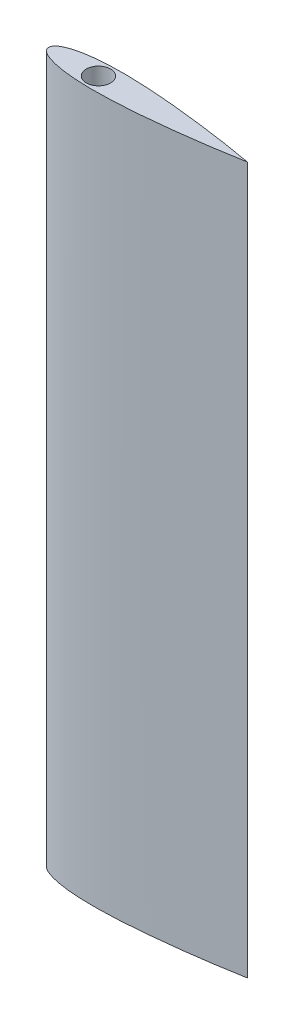
from build123d import *

# Parameters (mm, degrees)
SKETCH1_2_R        = 3.175
CUT_EXTRUDE2_DEPTH = 193.130237992


with BuildPart() as part:
    # rootSketch → Loft1 section 0
    with BuildSketch(Plane(origin=(0, 31.75, 0), x_dir=(1, 0, 0), z_dir=(0, 1, 0))):
        with BuildLine():
            add(Edge.make_bspline(
                [(0, 0), (-1.6572e-05, 0.056577364), (0.005364667, 0.148026672), (0.026073501, 0.280241396), (0.077769955, 0.452215412), (0.147060273, 0.611874915), (0.248525433, 0.785971359), (0.39236103, 0.977542518), (0.599181982, 1.195423819), (0.905829823, 1.451816919), (1.370469676, 1.757918922), (2.078266075, 2.119108524), (3.175731681, 2.542039428), (4.823252293, 2.99869744), (7.275411011, 3.452976612), (10.438659341, 3.780475746), (14.129329887, 3.929259057), (18.143568779, 3.896250983), (22.151742679, 3.722301475), (25.656241741, 3.475962342), (28.651461505, 3.213566971), (31.650711737, 2.914013348), (34.134157887, 2.639630917), (36.639458817, 2.336640809), (39.599525944, 1.953685828), (42.127939329, 1.60070159), (44.533194308, 1.24753169), (47.121130826, 0.837424538), (48.910319544, 0.545474341), (50.6553202, 0.241362714), (51.550989041, 0.081579679), (52, 0)],
                knots=[0, 0, 0, 0, 0, 0.003840944, 0.006235023, 0.009072291, 0.01219322, 0.015656839, 0.019917177, 0.025338962, 0.032592504, 0.042799388, 0.05770457, 0.079310668, 0.112503101, 0.158972616, 0.227236465, 0.295500326, 0.36376419, 0.432028053, 0.500291915, 0.534423847, 0.56855578, 0.636819643, 0.670951575, 0.705083508, 0.773347371, 0.807479302, 0.841611234, 0.875743167, 0.9098751, 0.9098751, 0.9098751, 0.9098751, 0.9098751], degree=4))
            add(Edge.make_bspline(
                [(0, 0), (-1.6572e-05, -0.056577364), (0.005364667, -0.148026672), (0.026073501, -0.280241396), (0.077769955, -0.452215412), (0.147060273, -0.611874915), (0.248525433, -0.785971359), (0.39236103, -0.977542518), (0.599181982, -1.195423819), (0.905829823, -1.451816919), (1.370469676, -1.757918922), (2.078266075, -2.119108524), (3.175731681, -2.542039428), (4.823252293, -2.99869744), (7.275411011, -3.452976612), (10.438659341, -3.780475746), (14.129329887, -3.929259057), (18.143568779, -3.896250983), (22.151742679, -3.722301475), (25.656241741, -3.475962342), (28.651461505, -3.213566971), (31.650711737, -2.914013348), (34.134157887, -2.639630917), (36.639458817, -2.336640809), (39.599525944, -1.953685828), (42.127939329, -1.60070159), (44.533194308, -1.24753169), (47.121130826, -0.837424538), (48.910319544, -0.545474341), (50.6553202, -0.241362714), (51.550989041, -0.081579679), (52, 0)],
                knots=[0, 0, 0, 0, 0, 0.003840944, 0.006235023, 0.009072291, 0.01219322, 0.015656839, 0.019917177, 0.025338962, 0.032592504, 0.042799388, 0.05770457, 0.079310668, 0.112503101, 0.158972616, 0.227236465, 0.295500326, 0.36376419, 0.432028053, 0.500291915, 0.534423847, 0.56855578, 0.636819643, 0.670951575, 0.705083508, 0.773347371, 0.807479302, 0.841611234, 0.875743167, 0.9098751, 0.9098751, 0.9098751, 0.9098751, 0.9098751], degree=4))
        make_face()
    # tipSketch → Loft1 section 1
    with BuildSketch(Plane(origin=(0, 216.6684, 0), x_dir=(1, 0, 0), z_dir=(0, 1, 0))):
        with BuildLine():
            add(Edge.make_bspline(
                [(0, 0), (-1.6572e-05, 0.056577364), (0.005364667, 0.148026672), (0.026073501, 0.280241396), (0.077769955, 0.452215412), (0.147060273, 0.611874915), (0.248525433, 0.785971359), (0.39236103, 0.977542518), (0.599181982, 1.195423819), (0.905829823, 1.451816919), (1.370469676, 1.757918922), (2.078266075, 2.119108524), (3.175731681, 2.542039428), (4.823252293, 2.99869744), (7.275411011, 3.452976612), (10.438659341, 3.780475746), (14.129329887, 3.929259057), (18.143568779, 3.896250983), (22.151742679, 3.722301475), (25.656241741, 3.475962342), (28.651461505, 3.213566971), (31.650711737, 2.914013348), (34.134157887, 2.639630917), (36.639458817, 2.336640809), (39.599525944, 1.953685828), (42.127939329, 1.60070159), (44.533194308, 1.24753169), (47.121130826, 0.837424538), (48.910319544, 0.545474341), (50.6553202, 0.241362714), (51.550989041, 0.081579679), (52, 0)],
                knots=[0, 0, 0, 0, 0, 0.003840944, 0.006235023, 0.009072291, 0.01219322, 0.015656839, 0.019917177, 0.025338962, 0.032592504, 0.042799388, 0.05770457, 0.079310668, 0.112503101, 0.158972616, 0.227236465, 0.295500326, 0.36376419, 0.432028053, 0.500291915, 0.534423847, 0.56855578, 0.636819643, 0.670951575, 0.705083508, 0.773347371, 0.807479302, 0.841611234, 0.875743167, 0.9098751, 0.9098751, 0.9098751, 0.9098751, 0.9098751], degree=4))
            add(Edge.make_bspline(
                [(0, 0), (-1.6572e-05, -0.056577364), (0.005364667, -0.148026672), (0.026073501, -0.280241396), (0.077769955, -0.452215412), (0.147060273, -0.611874915), (0.248525433, -0.785971359), (0.39236103, -0.977542518), (0.599181982, -1.195423819), (0.905829823, -1.451816919), (1.370469676, -1.757918922), (2.078266075, -2.119108524), (3.175731681, -2.542039428), (4.823252293, -2.99869744), (7.275411011, -3.452976612), (10.438659341, -3.780475746), (14.129329887, -3.929259057), (18.143568779, -3.896250983), (22.151742679, -3.722301475), (25.656241741, -3.475962342), (28.651461505, -3.213566971), (31.650711737, -2.914013348), (34.134157887, -2.639630917), (36.639458817, -2.336640809), (39.599525944, -1.953685828), (42.127939329, -1.60070159), (44.533194308, -1.24753169), (47.121130826, -0.837424538), (48.910319544, -0.545474341), (50.6553202, -0.241362714), (51.550989041, -0.081579679), (52, 0)],
                knots=[0, 0, 0, 0, 0, 0.003840944, 0.006235023, 0.009072291, 0.01219322, 0.015656839, 0.019917177, 0.025338962, 0.032592504, 0.042799388, 0.05770457, 0.079310668, 0.112503101, 0.158972616, 0.227236465, 0.295500326, 0.36376419, 0.432028053, 0.500291915, 0.534423847, 0.56855578, 0.636819643, 0.670951575, 0.705083508, 0.773347371, 0.807479302, 0.841611234, 0.875743167, 0.9098751, 0.9098751, 0.9098751, 0.9098751, 0.9098751], degree=4))
        make_face()
    loft()

    # Sketch1<2> → Cut-Extrude2 (cut, through all)
    with BuildSketch(Plane(origin=(0, 31.75, 0), x_dir=(1, 0, 0), z_dir=(0, 1, 0))):
        with Locations((12.999969404, 0)):
            Circle(SKETCH1_2_R)
    extrude(amount=CUT_EXTRUDE2_DEPTH, mode=Mode.SUBTRACT)


solid = part.part
